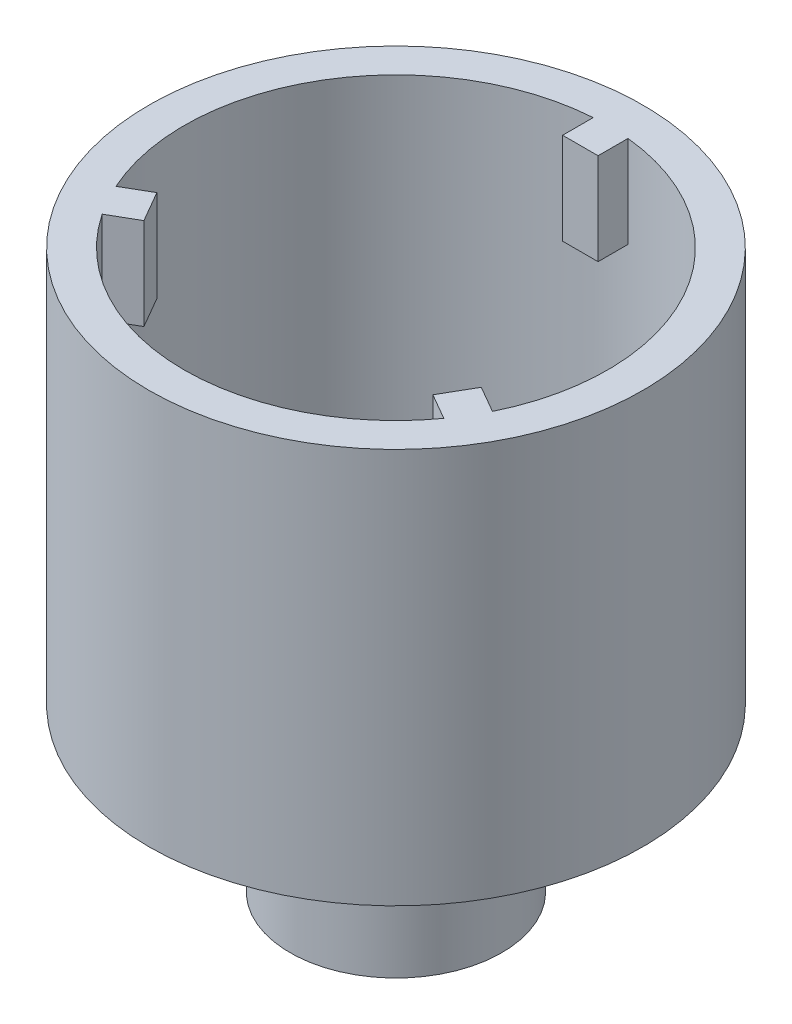
from build123d import *

# Parameters (mm, degrees)
SKETCH1_R           = 35
BOSS_EXTRUDE1_DEPTH = 56
SKETCH2_R           = 30
CUT_EXTRUDE1_DEPTH  = 46.9
SKETCH3_R           = 19.5
BOSS_EXTRUDE2_DEPTH = 7
SKETCH4_R           = 15
BOSS_EXTRUDE3_DEPTH = 16
FILLET1_R           = 5
BOSS_EXTRUDE4_DEPTH = 13


with BuildPart() as part:
    # Sketch1 → Boss-Extrude1 (new body)
    with BuildSketch(Plane(origin=(0, 0, 0), x_dir=(1, 0, 0), z_dir=(0, 1, 0))):
        Circle(SKETCH1_R)
    extrude(amount=BOSS_EXTRUDE1_DEPTH)

    # Sketch2 → Cut-Extrude1 (cut)
    with BuildSketch(Plane(origin=(0, 56, 0), x_dir=(1, 0, 0), z_dir=(0, 1, 0))):
        Circle(SKETCH2_R)
    extrude(amount=-CUT_EXTRUDE1_DEPTH, mode=Mode.SUBTRACT)

    # Sketch3 → Boss-Extrude2 (add)
    with BuildSketch(Plane.XZ):
        Circle(SKETCH3_R)
    extrude(amount=BOSS_EXTRUDE2_DEPTH)

    # Sketch4 → Boss-Extrude3 (add)
    with BuildSketch(Plane.XZ.offset(7)):
        Circle(SKETCH4_R)
    extrude(amount=BOSS_EXTRUDE3_DEPTH)

    # Fillet1
    fillet1_edges = [part.edges().sort_by_distance(p)[0] for p in [
        (-19.5, 0, 0),
    ]]
    fillet(fillet1_edges, radius=FILLET1_R)

    # Sketch5 → Boss-Extrude4 (add)
    with BuildSketch(Plane(origin=(0, 56, 0), x_dir=(1, 0, 0), z_dir=(0, 1, 0))):
        with BuildLine():
            Line((-1.990534123, 29.933890056), (-1.990534123, 25.605317076))
            Line((-1.990534123, 25.605317076), (3.030233114, 25.605317076))
            Line((3.030233114, 25.605317076), (3.030233114, 29.846569104))
            ThreePointArc((3.030233114, 29.846569104), (0.521679725, 29.995463828), (-1.990534123, 29.933890056))
        make_face()
        with BuildLine():
            Line((26.918776284, -13.243091911), (23.170122121, -11.07880542))
            Line((23.170122121, -11.07880542), (20.659738503, -15.426917394))
            Line((20.659738503, -15.426917394), (24.332770503, -17.547543408))
            ThreePointArc((24.332770503, -17.547543408), (25.715993811, -15.449519808), (26.918776284, -13.243091911))
        make_face()
        with BuildLine():
            Line((-24.928242161, -16.690798146), (-21.179587998, -14.526511655))
            Line((-21.179587998, -14.526511655), (-23.689971616, -10.178399682))
            Line((-23.689971616, -10.178399682), (-27.363003617, -12.299025696))
            ThreePointArc((-27.363003617, -12.299025696), (-26.237673536, -14.54594402), (-24.928242161, -16.690798146))
        make_face()
    extrude(amount=-BOSS_EXTRUDE4_DEPTH)


solid = part.part
